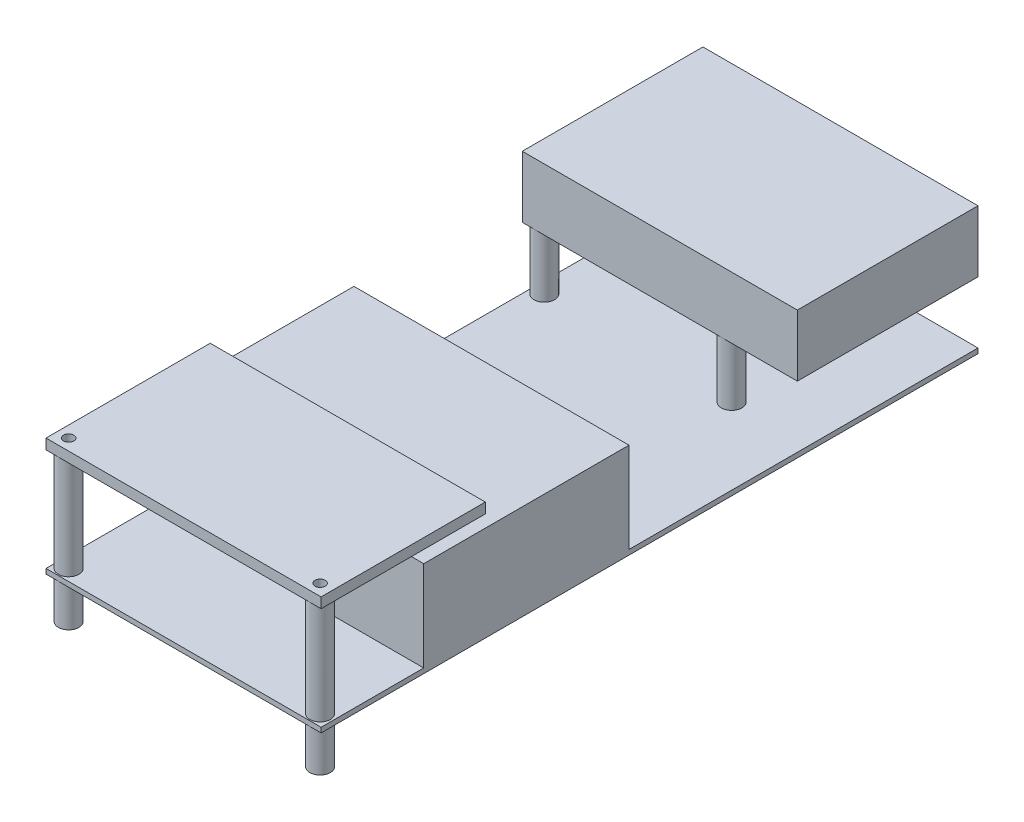
from build123d import *

# Parameters (mm, degrees)
SKETCH1_W           = 85.09
SKETCH1_H           = 203.2
BOSS_EXTRUDE1_DEPTH = 1.524
SKETCH2_R           = 1.5875
CUT_EXTRUDE1_DEPTH  = 221.30177184
SKETCH3_W           = 85.09
SKETCH3_H           = 63.5
BOSS_EXTRUDE2_DEPTH = 27.94
SKETCH4_R           = 3.175
BOSS_EXTRUDE3_DEPTH = 19.05
SKETCH5_W           = 85.09
SKETCH5_H           = 55.88
BOSS_EXTRUDE4_DEPTH = 19.05
BOSS_EXTRUDE5_START = 12.7
SKETCH6_R           = 3.175
BOSS_EXTRUDE5_DEPTH = 12.7
SKETCH7_R           = 3.175
BOSS_EXTRUDE6_DEPTH = 31.75
BOSS_EXTRUDE7_START = 3.175
SKETCH8_W           = 85.09
SKETCH8_H           = 50.8
SKETCH8_R           = 1.5875
BOSS_EXTRUDE7_DEPTH = 3.175


with BuildPart() as part:
    # Sketch1 → Boss-Extrude1 (new body)
    with BuildSketch(Plane(origin=(0, 0, 0), x_dir=(1, 0, 0), z_dir=(0, 1, 0))):
        with Locations((42.545, 101.6)):
            Rectangle(SKETCH1_W, SKETCH1_H)
    extrude(amount=BOSS_EXTRUDE1_DEPTH)

    # Sketch2 → Cut-Extrude1 (cut, through all)
    with BuildSketch(Plane(origin=(0, 1.524, 0), x_dir=(1, 0, 0), z_dir=(0, 1, 0))):
        with Locations((3.5052, 3.5052)):
            Circle(SKETCH2_R)
        with Locations((81.28, 3.5052)):
            Circle(SKETCH2_R)
        with Locations((3.5052, 199.644)):
            Circle(SKETCH2_R)
        with Locations((3.5052, 150.622)):
            Circle(SKETCH2_R)
        with Locations((61.468, 150.622)):
            Circle(SKETCH2_R)
        with Locations((61.468, 199.644)):
            Circle(SKETCH2_R)
    extrude(amount=-CUT_EXTRUDE1_DEPTH, mode=Mode.SUBTRACT)

    # Sketch3 → Boss-Extrude2 (add)
    with BuildSketch(Plane(origin=(0, 1.524, 0), x_dir=(1, 0, 0), z_dir=(0, 1, 0))):
        with Locations((42.545, 63.5)):
            Rectangle(SKETCH3_W, SKETCH3_H)
    extrude(amount=BOSS_EXTRUDE2_DEPTH)

    # Sketch4 → Boss-Extrude3 (add)
    with BuildSketch(Plane(origin=(0, 1.524, 0), x_dir=(1, 0, 0), z_dir=(0, 1, 0))):
        with Locations((3.5052, 199.644)):
            Circle(SKETCH4_R)
        with Locations((61.468, 199.644)):
            Circle(SKETCH4_R)
        with Locations((3.5052, 150.622)):
            Circle(SKETCH4_R)
        with Locations((61.468, 150.622)):
            Circle(SKETCH4_R)
    extrude(amount=BOSS_EXTRUDE3_DEPTH)

    # Sketch5 → Boss-Extrude4 (add)
    with BuildSketch(Plane(origin=(0, 20.574, 0), x_dir=(1, 0, 0), z_dir=(0, 1, 0))):
        with Locations((42.545, 175.26)):
            Rectangle(SKETCH5_W, SKETCH5_H)
    extrude(amount=BOSS_EXTRUDE4_DEPTH)

    # Sketch6 → Boss-Extrude5 (add)
    with BuildSketch(Plane.XZ.offset(BOSS_EXTRUDE5_START)):
        with Locations((3.5052, -3.5052)):
            Circle(SKETCH6_R)
        with Locations((81.28, -3.5052)):
            Circle(SKETCH6_R)
        with Locations((61.468, -150.622)):
            Circle(SKETCH6_R)
        with Locations((3.5052, -150.622)):
            Circle(SKETCH6_R)
        with Locations((3.5052, -199.644)):
            Circle(SKETCH6_R)
        with Locations((61.468, -199.644)):
            Circle(SKETCH6_R)
    extrude(amount=-BOSS_EXTRUDE5_DEPTH)

    # Sketch7 → Boss-Extrude6 (add)
    with BuildSketch(Plane(origin=(0, 1.524, 0), x_dir=(1, 0, 0), z_dir=(0, 1, 0))):
        with Locations((3.5052, 3.5052)):
            Circle(SKETCH7_R)
        with Locations((81.28, 3.5052)):
            Circle(SKETCH7_R)
    extrude(amount=BOSS_EXTRUDE6_DEPTH)

    # Sketch8 → Boss-Extrude7 (add)
    with BuildSketch(Plane(origin=(0, 33.274, 0), x_dir=(1, 0, 0), z_dir=(0, 1, 0)).offset(BOSS_EXTRUDE7_START)):
        with Locations((42.545, 25.4)):
            Rectangle(SKETCH8_W, SKETCH8_H)
        with Locations((81.28, 3.5052)):
            Circle(SKETCH8_R, mode=Mode.SUBTRACT)
        with Locations((3.5052, 3.5052)):
            Circle(SKETCH8_R, mode=Mode.SUBTRACT)
    extrude(amount=-BOSS_EXTRUDE7_DEPTH)


solid = part.part
